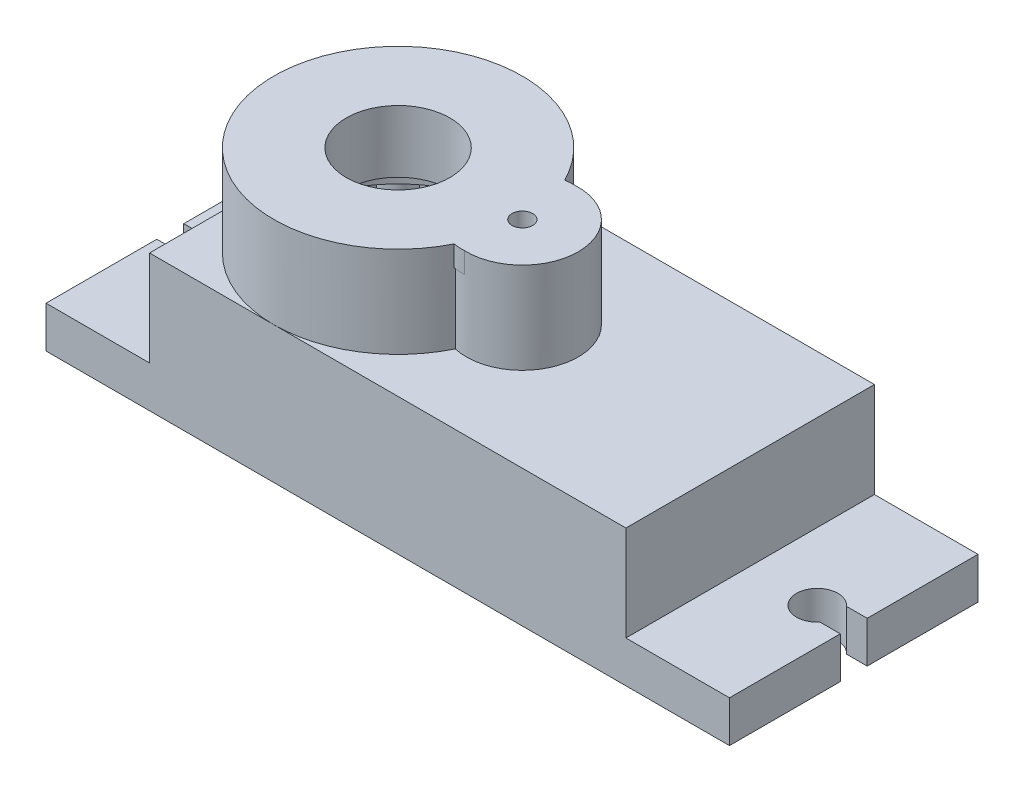
from build123d import *

# Parameters (mm, degrees)
SKETCH1_W                = 23
SKETCH1_H                = 12
BOSS_EXTRUDE1_DEPTH      = 6.6
BOSS_EXTRUDE2_DEPTH      = 5
BOSS_EXTRUDE2_DEPTH_BACK = 28
SKETCH2_W                = 12
SKETCH2_H                = 2
CUT_EXTRUDE1_DEPTH       = 5
SHELL3_OUTLINE_W         = 21
SHELL3_OUTLINE_H         = 10
SHELL3_DEPTH             = 5.6
SHELL3_2_DEPTH           = 1
SKETCH5_W                = 1
SKETCH5_H                = 10
BOSS_EXTRUDE4_DEPTH      = 1
SKETCH5_3_W              = 1
SKETCH5_3_H              = 10
BOSS_EXTRUDE5_DEPTH      = 1
BOSS_EXTRUDE6_DEPTH      = 4.4
CUT_EXTRUDE2_DEPTH       = 19.756598839
BOSS_EXTRUDE7_START      = -1
BOSS_EXTRUDE7_DEPTH      = 1
SKETCH21_R               = 2.5
SKETCH21_R_2             = 0.5
CUT_EXTRUDE3_DEPTH       = 21.718349355
SKETCH22_R               = 5.5
SKETCH22_R_2             = 0.8
CUT_EXTRUDE4_DEPTH       = 19.42851052
SKETCH23_R               = 0.8
SKETCH23_R_2             = 0.3
BOSS_EXTRUDE9_DEPTH      = 2.5
SKETCH25_R               = 3.5
SKETCH25_R_2             = 2.5
BOSS_EXTRUDE10_DEPTH     = 2


# Read off the part's stored shape, not the designer's step: Shell3
with BuildPart() as part:
    # Sketch1 → Boss-Extrude1 (new body)
    with BuildSketch(Plane(origin=(0, 0, 0), x_dir=(1, 0, 0), z_dir=(0, 1, 0))):
        Rectangle(SKETCH1_W, SKETCH1_H)
    extrude(amount=BOSS_EXTRUDE1_DEPTH)

    # Sketch2 → Boss-Extrude2 (add, two sides: drawn at the far end of the back side and taken through both)
    with BuildSketch(Plane(origin=(11.5, 0, 0), x_dir=(0, 0, -1), z_dir=(1, 0, 0)).offset(-BOSS_EXTRUDE2_DEPTH_BACK)):
        with Locations((0, 1)):
            Rectangle(SKETCH2_W, SKETCH2_H)
    extrude(amount=BOSS_EXTRUDE2_DEPTH + BOSS_EXTRUDE2_DEPTH_BACK)

    # Sketch3 → Cut-Extrude1 (cut)
    with BuildSketch(Plane(origin=(0, 2, 0), x_dir=(1, 0, 0), z_dir=(0, 1, 0))):
        with BuildLine():
            Line((16.5, 0.65), (15.5, 0.65))
            ThreePointArc((15.5, 0.65), (13.750113293, -0.026490152), (15.519570239, -0.65))
            Line((15.519570239, -0.65), (16.5, -0.65))
            Line((16.5, -0.65), (16.5, 0.65))
        make_face()
        with BuildLine():
            Line((-16.5, -0.65), (-16.5, 0.65))
            Line((-16.5, 0.65), (-15.5, 0.65))
            ThreePointArc((-15.5, 0.65), (-13.750113293, -0.026490152), (-15.519570239, -0.65))
            Line((-15.519570239, -0.65), (-16.5, -0.65))
        make_face()
    extrude(amount=-CUT_EXTRUDE1_DEPTH, mode=Mode.SUBTRACT)

    # Shell3 outline → Shell3 (cut)
    with BuildSketch(Plane(origin=(0, 0, 0), x_dir=(1, 0, 0), z_dir=(0, 1, 0))):
        Rectangle(SHELL3_OUTLINE_W, SHELL3_OUTLINE_H)
    extrude(amount=SHELL3_DEPTH, mode=Mode.SUBTRACT)

    # Shell3 2 outline → Shell3 2 (cut)
    with BuildSketch(Plane(origin=(0, 0, 0), x_dir=(1, 0, 0), z_dir=(0, 1, 0))):
        with BuildLine():
            ThreePointArc((-15.5, 1.842611794), (-12.75, -0.011437828), (-15.5, -1.86548745))
            Line((-15.5, -1.86548745), (-15.5, -5))
            Line((-15.5, -5), (-10.5, -5))
            Line((-10.5, -5), (-10.5, 5))
            Line((-10.5, 5), (-15.5, 5))
            Line((-15.5, 5), (-15.5, 1.842611794))
        make_face()
        with BuildLine():
            Line((10.5, 5), (10.5, -5))
            Line((10.5, -5), (15.5, -5))
            Line((15.5, -5), (15.5, -1.86548745))
            ThreePointArc((15.5, -1.86548745), (12.75, -0.011437828), (15.5, 1.842611794))
            Line((15.5, 1.842611794), (15.5, 5))
            Line((15.5, 5), (10.5, 5))
        make_face()
    extrude(amount=SHELL3_2_DEPTH, mode=Mode.SUBTRACT)

    # Sketch5 → Boss-Extrude4 (add)
    with BuildSketch(Plane.XZ.offset(-1)):
        with Locations((11, 0)):
            Rectangle(SKETCH5_W, SKETCH5_H)
    extrude(amount=BOSS_EXTRUDE4_DEPTH)

    # Sketch5<3> → Boss-Extrude5 (add)
    with BuildSketch(Plane.XZ.offset(-1)):
        with Locations((11, 0)):
            Rectangle(SKETCH5_3_W, SKETCH5_3_H)
        with Locations((-11, 0)):
            Rectangle(SKETCH5_3_W, SKETCH5_3_H)
    extrude(amount=BOSS_EXTRUDE5_DEPTH)

    # Sketch7 → Boss-Extrude6 (add)
    with BuildSketch(Plane(origin=(0, 6.6, 0), x_dir=(1, 0, 0), z_dir=(0, 1, 0))):
        with BuildLine():
            ThreePointArc((-0.1075, 2.630768661), (-11.5, 0), (-0.1075, -2.630768661))
            ThreePointArc((-0.1075, -2.630768661), (3.2, 0), (-0.1075, 2.630768661))
        make_face()
        with BuildLine():
            ThreePointArc((-0.3825, -2.01524037), (2.7, 0), (-0.3825, 2.01524037))
            ThreePointArc((-0.3825, 2.01524037), (-11, 0), (-0.3825, -2.01524037))
        make_face(mode=Mode.SUBTRACT)
    extrude(amount=BOSS_EXTRUDE6_DEPTH)

    # Sketch19 → Cut-Extrude2 (cut, through all)
    with BuildSketch(Plane(origin=(0, 6.6, 0), x_dir=(1, 0, 0), z_dir=(0, 1, 0))):
        with BuildLine():
            ThreePointArc((-0.409482759, 2.082458695), (-11, 0), (-0.409482759, -2.082458695))
            ThreePointArc((-0.409482759, -2.082458695), (2.5, 0), (-0.409482759, 2.082458695))
        make_face()
    extrude(amount=-CUT_EXTRUDE2_DEPTH, mode=Mode.SUBTRACT)

    # Sketch20 → Boss-Extrude7 (add)
    with BuildSketch(Plane(origin=(0, 11, 0), x_dir=(1, 0, 0), z_dir=(0, 1, 0)).offset(BOSS_EXTRUDE7_START)):
        with BuildLine():
            ThreePointArc((-0.125, 2.666341126), (-11.5, 0), (-0.125, -2.666341126))
            ThreePointArc((-0.125, -2.666341126), (3, 0), (-0.125, 2.666341126))
        make_face()
    extrude(amount=BOSS_EXTRUDE7_DEPTH)

    # Sketch21 → Cut-Extrude3 (cut, through all)
    with BuildSketch(Plane(origin=(0, 11, 0), x_dir=(1, 0, 0), z_dir=(0, 1, 0))):
        with Locations(Location((-5.5, 0, 0), (0, 0, 270))):
            Circle(SKETCH21_R)
        with Locations(Location((0.5, 0, 0), (0, 0, 270))):
            Circle(SKETCH21_R_2)
    extrude(amount=-CUT_EXTRUDE3_DEPTH, mode=Mode.SUBTRACT)

    # Sketch22 → Cut-Extrude4 (cut, through all)
    with BuildSketch(Plane.XZ.offset(-5.6)):
        with Locations((0.5, 0)):
            Circle(SKETCH22_R)
        with Locations((-10.2, 4.7)):
            Circle(SKETCH22_R_2)
        with Locations((-10.2, -4.7)):
            Circle(SKETCH22_R_2)
        with Locations((10.2, -4.7)):
            Circle(SKETCH22_R_2)
        with Locations((10.2, 4.7)):
            Circle(SKETCH22_R_2)
    extrude(amount=CUT_EXTRUDE4_DEPTH, mode=Mode.SUBTRACT)

    # Sketch23 → Boss-Extrude9 (add)
    # profile 1 of 4: a face of its own
    with BuildSketch(Plane.XZ.offset(-5.6)):
        with Locations((-10.2, 4.7)):
            Circle(SKETCH23_R)
        with Locations(Location((-10.2, 4.7, 0), (0, 0, 270))):
            Circle(SKETCH23_R_2, mode=Mode.SUBTRACT)
    # profile 2 of 4: a face of its own
    with BuildSketch(Plane.XZ.offset(-5.6)):
        with Locations((-10.2, -4.7)):
            Circle(SKETCH23_R)
        with Locations(Location((-10.2, -4.7, 0), (0, 0, 90))):
            Circle(SKETCH23_R_2, mode=Mode.SUBTRACT)
    # profile 3 of 4: a face of its own
    with BuildSketch(Plane.XZ.offset(-5.6)):
        with Locations((10.2, -4.7)):
            Circle(SKETCH23_R)
        with Locations(Location((10.2, -4.7, 0), (0, 0, 270))):
            Circle(SKETCH23_R_2, mode=Mode.SUBTRACT)
    # profile 4 of 4: a face of its own
    with BuildSketch(Plane.XZ.offset(-5.6)):
        with Locations((10.2, 4.7)):
            Circle(SKETCH23_R)
        with Locations(Location((10.2, 4.7, 0), (0, 0, 90))):
            Circle(SKETCH23_R_2, mode=Mode.SUBTRACT)
    extrude(amount=BOSS_EXTRUDE9_DEPTH)

    # Sketch25 → Boss-Extrude10 (add)
    with BuildSketch(Plane.XZ.offset(-10)):
        with Locations(Location((-5.5, 0, 0), (0, 0, 90))):
            Circle(SKETCH25_R)
        with Locations(Location((-5.5, 0, 0), (0, 0, 90))):
            Circle(SKETCH25_R_2, mode=Mode.SUBTRACT)
    extrude(amount=BOSS_EXTRUDE10_DEPTH)


solid = part.part
